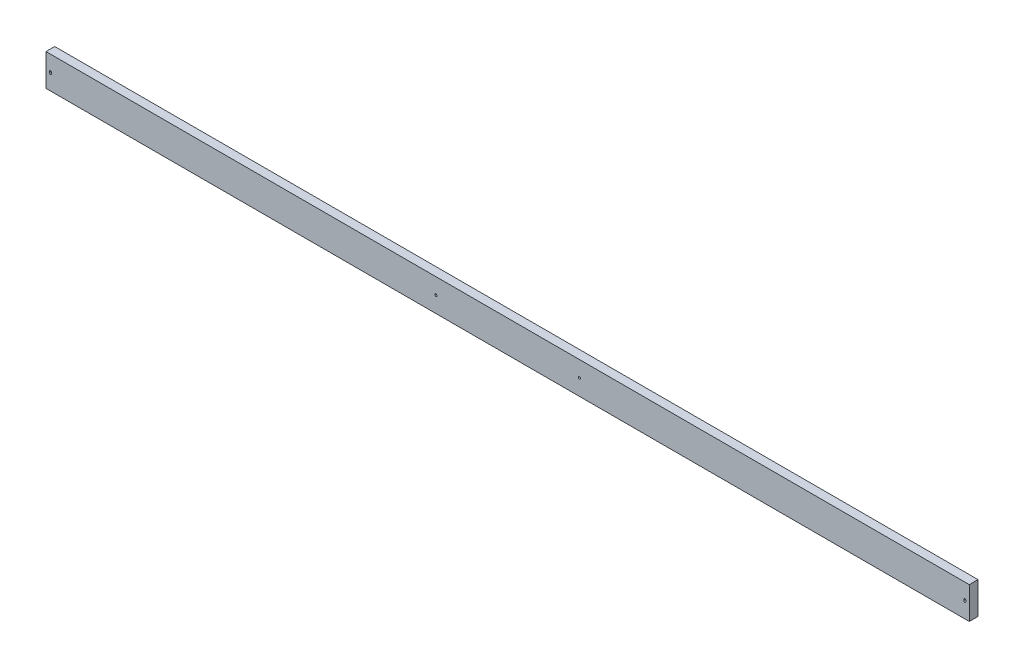
from build123d import *

# Parameters (mm, degrees)
SKETCH1_W           = 4038.6
SKETCH1_H           = 139.7
BOSS_EXTRUDE1_DEPTH = 38.1
CUT_EXTRUDE1_DEPTH  = 4042.195078192
SKETCH3_R           = 4.7625
CUT_EXTRUDE2_DEPTH  = 4042.195078192


with BuildPart() as part:
    # Sketch1 → Boss-Extrude1 (new body)
    with BuildSketch(Plane.XY):
        with Locations((2019.3, -69.85)):
            Rectangle(SKETCH1_W, SKETCH1_H)
    extrude(amount=BOSS_EXTRUDE1_DEPTH)

    # Sketch2 → Cut-Extrude1 (cut, through all)
    with BuildSketch(Plane.XY.offset(38.1)):
        with BuildLine():
            Line((24.0114, -67.443303433), (24.0114, -72.447103433))
            ThreePointArc((24.0114, -72.447103433), (19.463292082, -76.947355196), (15.0114, -72.3519))
            Line((15.0114, -72.3519), (15.0114, -67.3481))
            ThreePointArc((15.0114, -67.3481), (19.558500841, -62.943051671), (24.0114, -67.443303433))
        make_face()
        with BuildLine():
            Line((4023.5886, -67.3481), (4023.5886, -72.3519))
            ThreePointArc((4023.5886, -72.3519), (4019.040492082, -76.852151762), (4014.5886, -72.256696567))
            Line((4014.5886, -72.256696567), (4014.5886, -67.252896567))
            ThreePointArc((4014.5886, -67.252896567), (4019.135700841, -62.847848238), (4023.5886, -67.3481))
        make_face()
    extrude(amount=-CUT_EXTRUDE1_DEPTH, mode=Mode.SUBTRACT)

    # Sketch3 → Cut-Extrude2 (cut, through all)
    with BuildSketch(Plane.XY.offset(38.1)):
        with Locations((2333.1678, -69.85)):
            Circle(SKETCH3_R)
        with Locations((1705.4322, -69.85)):
            Circle(SKETCH3_R)
    extrude(amount=-CUT_EXTRUDE2_DEPTH, mode=Mode.SUBTRACT)


solid = part.part
